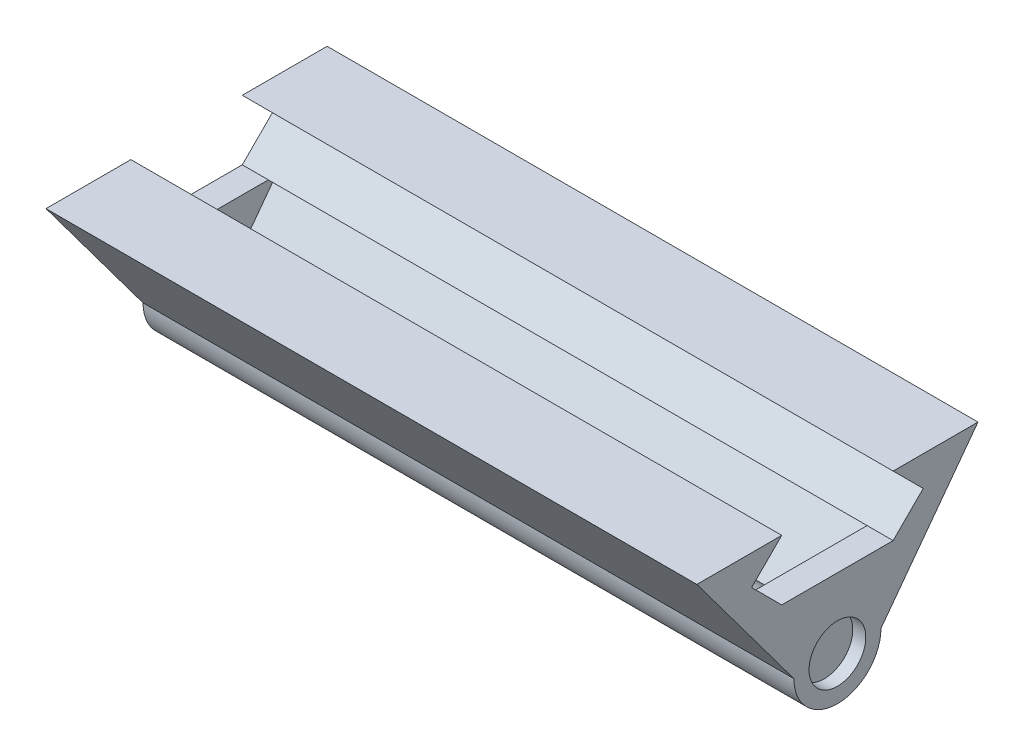
from build123d import *

# Parameters (mm, degrees)
BOSS_EXTRUDE1_DEPTH = 15.875
SHELL1_START        = -14.605
SHELL1_DEPTH        = 29.21
SKETCH3_R           = 1.383918908
CUT_EXTRUDE2_DEPTH  = 0.635


# Read off the part's stored shape, not the designer's step: Shell1
with BuildPart() as part:
    # Sketch1 → Boss-Extrude1 (new, symmetric)
    with BuildSketch(Plane(origin=(0, 0, 0), x_dir=(0, 0, -1), z_dir=(1, 0, 0))):
        with BuildLine():
            Line((6.857311765, -3.076782348), (2.123637644, -9.426782348))
            ThreePointArc((2.123637644, -9.426782348), (0, -11.550419992), (-2.123637644, -9.426782348))
            Line((-2.123637644, -9.426782348), (-6.857311765, -3.076782348))
            Line((-6.857311765, -3.076782348), (-2.717266513, -3.076782348))
            Line((-2.717266513, -3.076782348), (-4.18616331, -4.545679146))
            Line((-4.18616331, -4.545679146), (-2.717266513, -6.014575943))
            Line((-2.717266513, -6.014575943), (2.717266513, -6.014575943))
            Line((2.717266513, -6.014575943), (4.18616331, -4.545679146))
            Line((4.18616331, -4.545679146), (2.717266513, -3.076782348))
            Line((2.717266513, -3.076782348), (6.857311765, -3.076782348))
        make_face()
    extrude(amount=BOSS_EXTRUDE1_DEPTH, both=True)

    # Shell1 outline → Shell1 (cut)
    with BuildSketch(Plane.YZ.offset(SHELL1_START)):
        with BuildLine():
            Line((-6.014575943, -3.083255099), (-6.014575943, 3.083255099))
            Line((-6.014575943, 3.083255099), (-9.095341146, 0.786666357))
            ThreePointArc((-9.095341146, 0.786666357), (-10.280419992, 0), (-9.095341146, -0.786666357))
            Line((-9.095341146, -0.786666357), (-6.014575943, -3.083255099))
        make_face()
    extrude(amount=SHELL1_DEPTH, mode=Mode.SUBTRACT)

    # Sketch3 → Cut-Extrude2 (cut)
    with BuildSketch(Plane.ZY.offset(15.875)):
        with Locations((0, -9.426782348)):
            Circle(SKETCH3_R)
    cut_extrude2 = extrude(amount=-CUT_EXTRUDE2_DEPTH, mode=Mode.SUBTRACT)

    # Mirror1: Cut-Extrude2 across plane
    add(cut_extrude2.mirror(Plane(origin=(0, 0, 0), x_dir=(0, 0, 1), z_dir=(1, 0, 0))), mode=Mode.SUBTRACT)


solid = part.part
